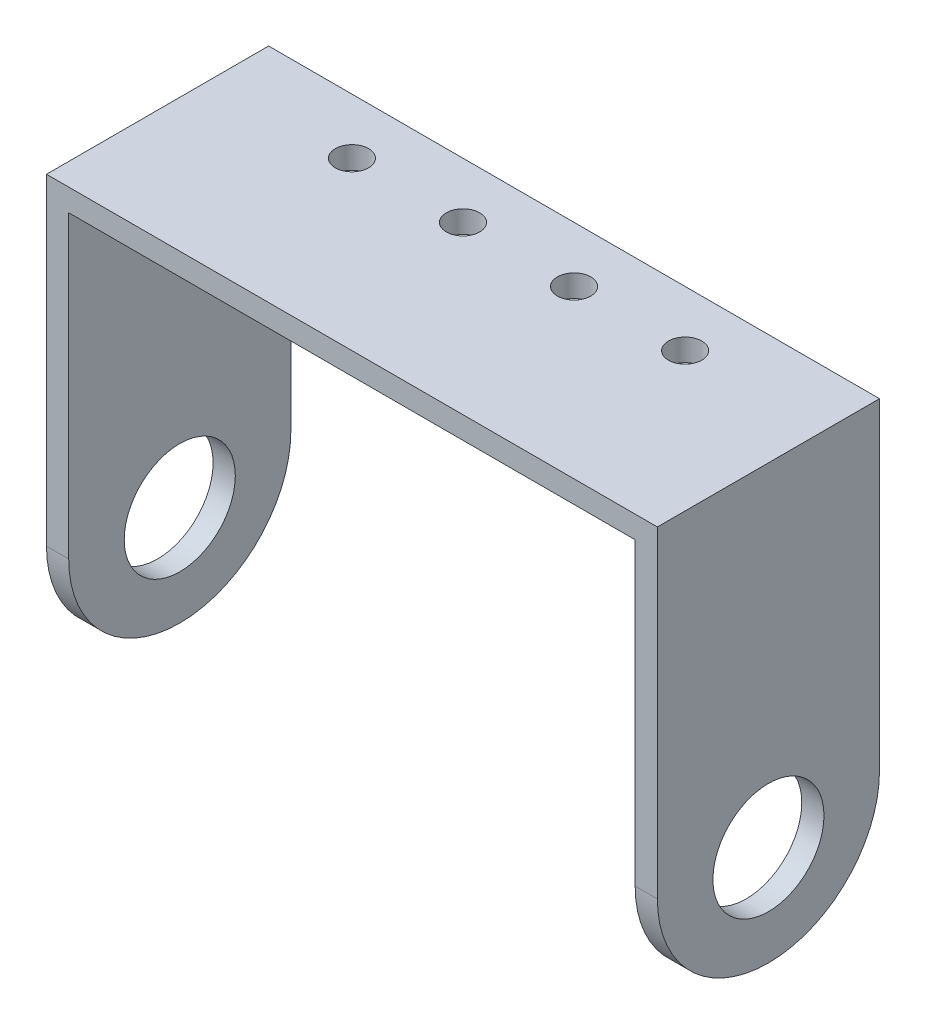
from build123d import *

# Parameters (mm, degrees)
SKETCH1_W           = 55
SKETCH1_H           = 20
BOSS_EXTRUDE1_DEPTH = 2
SKETCH2_W           = 2
SKETCH2_H           = 20
BOSS_EXTRUDE2_DEPTH = 37
SKETCH3_R           = 5
CUT_EXTRUDE1_DEPTH  = 69.161572752
CUT_EXTRUDE2_DEPTH  = 69.161572752
SKETCH5_R           = 1.5
CUT_EXTRUDE3_DEPTH  = 49.757050772


with BuildPart() as part:
    # Sketch1 → Boss-Extrude1 (new body)
    with BuildSketch(Plane(origin=(0, 0, 0), x_dir=(1, 0, 0), z_dir=(0, 1, 0))):
        Rectangle(SKETCH1_W, SKETCH1_H)
    extrude(amount=-BOSS_EXTRUDE1_DEPTH)

    # Sketch2 → Boss-Extrude2 (add)
    with BuildSketch(Plane.XZ.offset(2)):
        with Locations((-26.5, 0)):
            Rectangle(SKETCH2_W, SKETCH2_H)
        with Locations((26.5, 0)):
            Rectangle(SKETCH2_W, SKETCH2_H)
    extrude(amount=BOSS_EXTRUDE2_DEPTH)

    # Sketch3 → Cut-Extrude1 (cut, through all)
    with BuildSketch(Plane(origin=(27.5, 0, 0), x_dir=(0, 0, -1), z_dir=(1, 0, 0))):
        with Locations((0, -30)):
            Circle(SKETCH3_R)
    extrude(amount=-CUT_EXTRUDE1_DEPTH, mode=Mode.SUBTRACT)

    # Sketch4 → Cut-Extrude2 (cut, through all)
    with BuildSketch(Plane.ZY.offset(27.5)):
        with BuildLine():
            Line((10, -39), (10, -29))
            ThreePointArc((10, -29), (7.071067812, -36.071067812), (0, -39))
            Line((0, -39), (10, -39))
        make_face()
        with BuildLine():
            ThreePointArc((0, -39), (-7.071067812, -36.071067812), (-10, -29))
            Line((-10, -29), (-10, -39))
            Line((-10, -39), (0, -39))
        make_face()
    extrude(amount=-CUT_EXTRUDE2_DEPTH, mode=Mode.SUBTRACT)

    # Sketch5 → Cut-Extrude3 (cut, through all)
    with BuildSketch(Plane(origin=(0, 0, 0), x_dir=(1, 0, 0), z_dir=(0, 1, 0))):
        with Locations((5, 5)):
            Circle(SKETCH5_R)
        with Locations((15, 5)):
            Circle(SKETCH5_R)
        with Locations((-15, 5)):
            Circle(SKETCH5_R)
        with Locations((-5, 5)):
            Circle(SKETCH5_R)
    extrude(amount=-CUT_EXTRUDE3_DEPTH, mode=Mode.SUBTRACT)


solid = part.part
